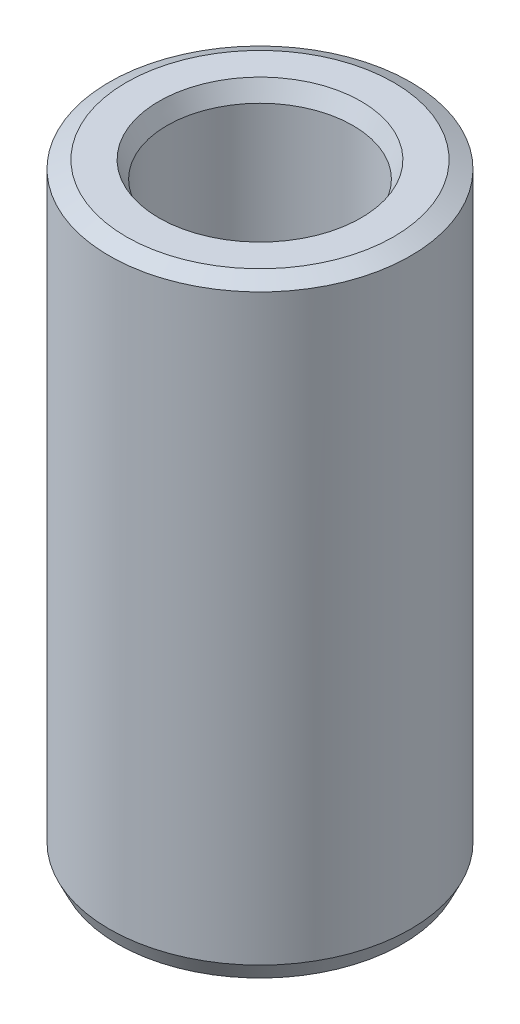
from build123d import *
from OCP.BRepFilletAPI import BRepFilletAPI_MakeChamfer

# Parameters (mm, degrees)
SKETCH1_R           = 57.5
BOSS_EXTRUDE1_DEPTH = 232.121431129
SKETCH2_R           = 35.483115973
CUT_EXTRUDE1_DEPTH  = 246.952960522
CHAMFER1_SIZE       = 3.103185851
CHAMFER1_SIZE2      = 6.456512887


with BuildPart() as part:
    # Sketch1 → Boss-Extrude1 (new body)
    with BuildSketch(Plane(origin=(0, 0, 0), x_dir=(1, 0, 0), z_dir=(0, 1, 0))):
        Circle(SKETCH1_R)
    extrude(amount=BOSS_EXTRUDE1_DEPTH)

    # Sketch2 → Cut-Extrude1 (cut, through all)
    with BuildSketch(Plane(origin=(0, 0, 0), x_dir=(1, 0, 0), z_dir=(0, 1, 0))):
        Circle(SKETCH2_R)
    extrude(amount=CUT_EXTRUDE1_DEPTH, mode=Mode.SUBTRACT)

    # Chamfer1: one chamfer whose edges measure the first distance from different faces: ONE call of the kernel's chamfer builder (chamfer() names one face for all edges)
    chamfer1_edges_1 = [part.edges().sort_by_distance(p)[0] for p in [
        (-35.483115973, 232.121431129, 0),
    ]]
    chamfer1_side_1 = [part.faces().sort_by_distance(p)[0] for p in [
        (-55.873654403, 232.121431129, 0),
    ]]
    chamfer1_edges_2 = [part.edges().sort_by_distance(p)[0] for p in [
        (-35.483115973, 0, 0),
    ]]
    chamfer1_side_2 = [part.faces().sort_by_distance(p)[0] for p in [
        (-35.483115973, 116.060715565, 0),
    ]]
    chamfer1_edges_3 = [part.edges().sort_by_distance(p)[0] for p in [
        (-57.5, 0, 0),
    ]]
    chamfer1_side_3 = [part.faces().sort_by_distance(p)[0] for p in [
        (-55.873654403, 0, 0),
    ]]
    chamfer1_edges_4 = [part.edges().sort_by_distance(p)[0] for p in [
        (-57.5, 232.121431129, 0),
    ]]
    chamfer1_side_4 = [part.faces().sort_by_distance(p)[0] for p in [
        (-57.5, 116.060715565, 0),
    ]]
    chamfer1 = BRepFilletAPI_MakeChamfer(part.part.solid().wrapped)
    for e in chamfer1_edges_1:
        chamfer1.Add(CHAMFER1_SIZE, CHAMFER1_SIZE2, e.wrapped, chamfer1_side_1[0].wrapped)  # the first distance lies on this face
    for e in chamfer1_edges_2:
        chamfer1.Add(CHAMFER1_SIZE, CHAMFER1_SIZE2, e.wrapped, chamfer1_side_2[0].wrapped)  # the first distance lies on this face
    for e in chamfer1_edges_3:
        chamfer1.Add(CHAMFER1_SIZE, CHAMFER1_SIZE2, e.wrapped, chamfer1_side_3[0].wrapped)  # the first distance lies on this face
    for e in chamfer1_edges_4:
        chamfer1.Add(CHAMFER1_SIZE, CHAMFER1_SIZE2, e.wrapped, chamfer1_side_4[0].wrapped)  # the first distance lies on this face
    add(Compound.cast(chamfer1.Shape()), mode=Mode.REPLACE)


solid = part.part
